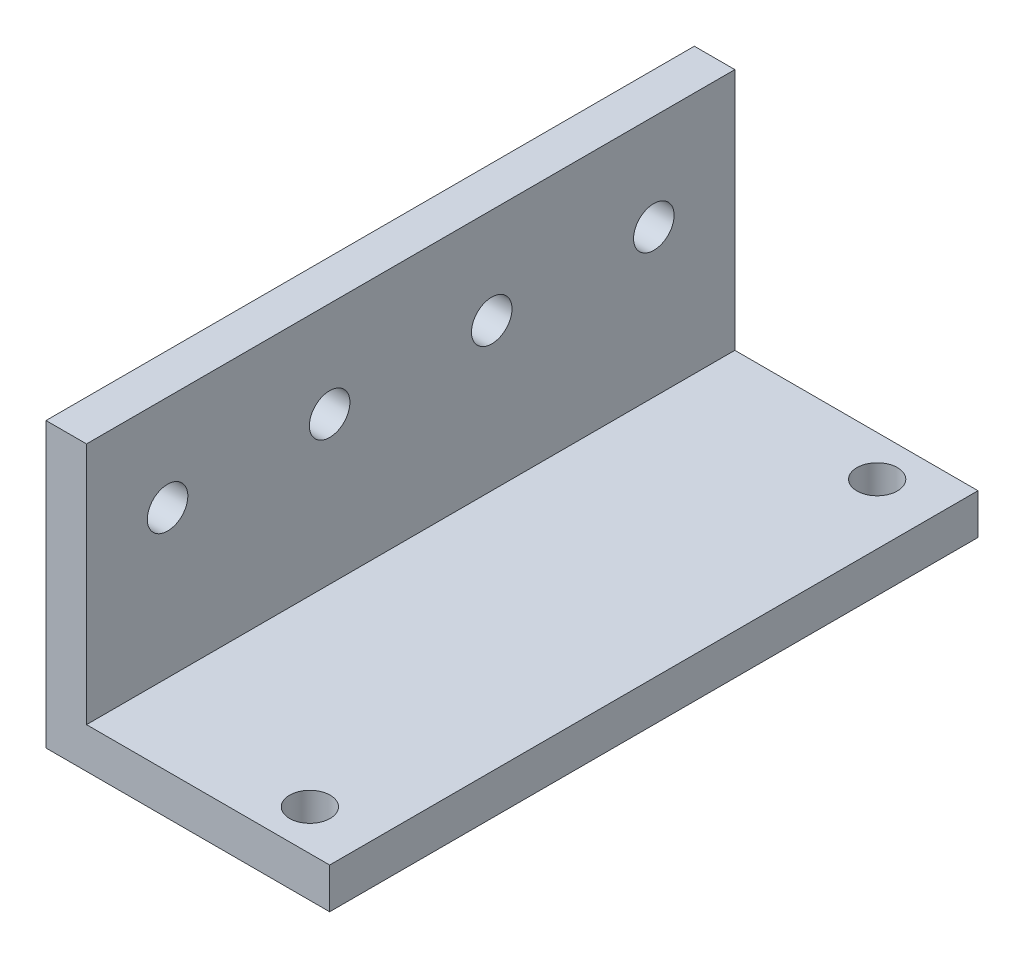
from build123d import *

# Parameters (mm, degrees)
BOSS_EXTRUDE1_DEPTH = 101.6
SKETCH2_R           = 3.175
CUT_EXTRUDE1_DEPTH  = 25.146
SKETCH3_R           = 3.175
CUT_EXTRUDE2_DEPTH  = 25.146


with BuildPart() as part:
    # Sketch1 → Boss-Extrude1 (new body)
    with BuildSketch(Plane.XY):
        Polygon((0, 44.45), (0, 0), (44.45, 0), (44.45, 6.35), (6.35, 6.35), (6.35, 44.45), align=None)
    extrude(amount=BOSS_EXTRUDE1_DEPTH)

    # Sketch2 → Cut-Extrude1 (cut)
    with BuildSketch(Plane(origin=(0, 6.35, 0), x_dir=(1, 0, 0), z_dir=(0, 1, 0))):
        with Locations((35, -95.25)):
            Circle(SKETCH2_R)
        with Locations((35, -6.35)):
            Circle(SKETCH2_R)
    extrude(amount=-CUT_EXTRUDE1_DEPTH, mode=Mode.SUBTRACT)

    # Sketch3 → Cut-Extrude2 (cut)
    with BuildSketch(Plane(origin=(6.35, 0, 0), x_dir=(0, 0, -1), z_dir=(1, 0, 0))):
        with Locations((-12.7, 29.45)):
            Circle(SKETCH3_R)
        with Locations((-63.5, 29.45)):
            Circle(SKETCH3_R)
        with Locations((-88.9, 29.45)):
            Circle(SKETCH3_R)
        with Locations((-38.1, 29.45)):
            Circle(SKETCH3_R)
    extrude(amount=-CUT_EXTRUDE2_DEPTH, mode=Mode.SUBTRACT)


solid = part.part
